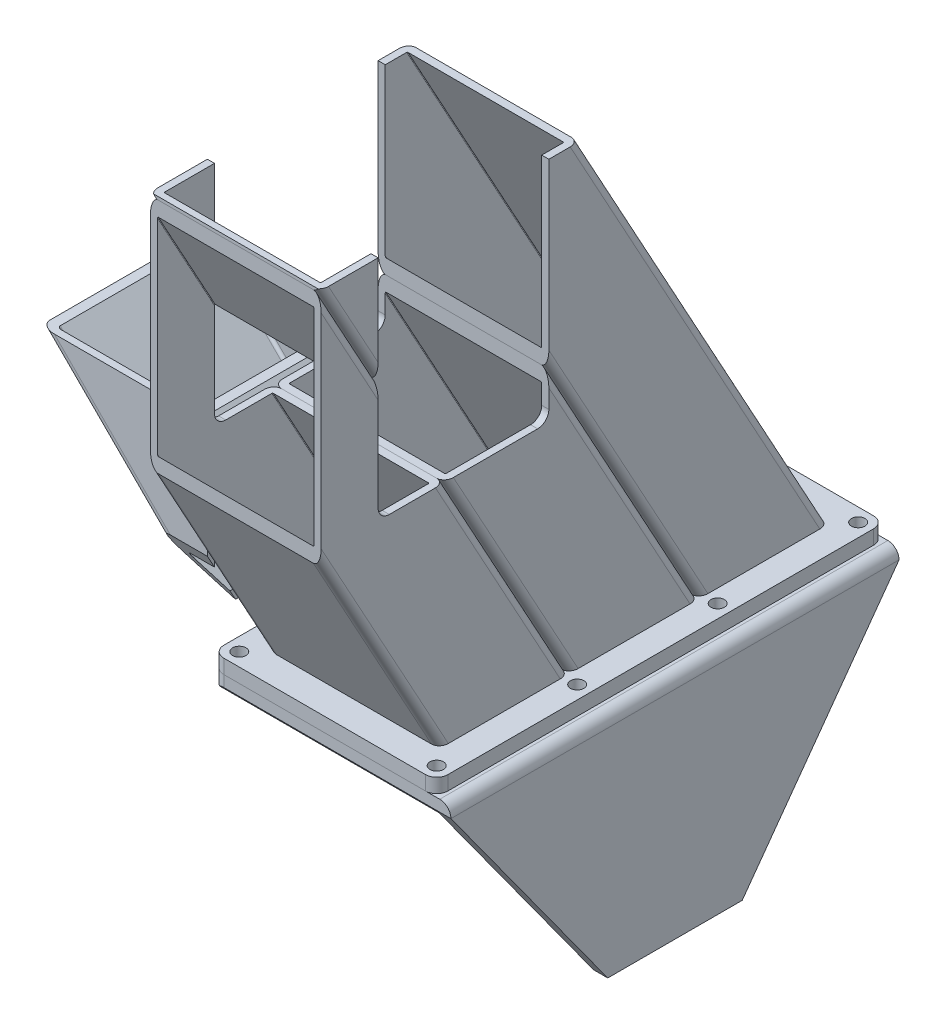
from build123d import *

# Parameters (mm, degrees)
BOSS_EXTRUDE1_DEPTH             = 328
BOSS_EXTRUDE1_DEPTH_BACK        = 70
CUT_EXTRUDE2_DEPTH              = 440.718513339
CUT_EXTRUDE2_DEPTH_BACK         = 328
SKETCH4_W                       = 313.0169186
SKETCH4_H                       = 132.220402889
SKETCH5_W                       = 100
SKETCH5_H                       = 200
SKETCH5_R                       = 3
BOSS_EXTRUDE2_DEPTH             = 6.35
FILLET1_R                       = 5
BOSS_EXTRUDE3_REACH             = 324.435
BOSS_EXTRUDE3_DIRECTION_2_REACH = 324.435
CUT_EXTRUDE3_DEPTH              = 166.35
DELETEFACE1_DEPTH               = 6.35
SKETCH9_W                       = 6.35
SKETCH9_H                       = 101.6
BOSS_EXTRUDE4_DEPTH             = 200
FILLET2_R                       = 5
CUT_EXTRUDE4_DEPTH              = 186.35


# Read off the part's stored shape, not the designer's step: DeleteFace1
with BuildPart() as part:
    # Sketch3 → Boss-Extrude1 (new, two sides: drawn at the far end of the back side and taken through both)
    with BuildSketch(Plane(origin=(0, 246.475671751, 135.020209169), x_dir=(-1, 0, 0), z_dir=(0, -0.8770281479329048, -0.4804389948093086)).offset(-BOSS_EXTRUDE1_DEPTH_BACK)):
        with BuildLine():
            Line((-3.5, -5.7132711), (-72.7, -5.7132711))
            ThreePointArc((-72.7, -5.7132711), (-75.174873734, -6.738397366), (-76.2, -9.2132711))
            Line((-76.2, -9.2132711), (-76.2, -53.0132711))
            ThreePointArc((-76.2, -53.0132711), (-75.174873734, -55.488144834), (-72.7, -56.5132711))
            Line((-72.7, -56.5132711), (-3.5, -56.5132711))
            ThreePointArc((-3.5, -56.5132711), (-1.025126266, -55.488144834), (0, -53.0132711))
            Line((0, -53.0132711), (0, -9.2132711))
            ThreePointArc((0, -9.2132711), (-1.025126266, -6.738397366), (-3.5, -5.7132711))
        make_face()
        with BuildLine():
            Line((-3.175, -9.2132711), (-3.175, -53.0132711))
            ThreePointArc((-3.175, -53.0132711), (-3.270190296, -53.243080804), (-3.5, -53.3382711))
            Line((-3.5, -53.3382711), (-72.7, -53.3382711))
            ThreePointArc((-72.7, -53.3382711), (-72.929809704, -53.243080804), (-73.025, -53.0132711))
            Line((-73.025, -53.0132711), (-73.025, -9.2132711))
            ThreePointArc((-73.025, -9.2132711), (-72.929809704, -8.983461396), (-72.7, -8.8882711))
            Line((-72.7, -8.8882711), (-3.5, -8.8882711))
            ThreePointArc((-3.5, -8.8882711), (-3.270190296, -8.983461396), (-3.175, -9.2132711))
        make_face(mode=Mode.SUBTRACT)
    extrude(amount=BOSS_EXTRUDE1_DEPTH + BOSS_EXTRUDE1_DEPTH_BACK)


with BuildPart() as body_2:
    # Mirror1: mirrored copy
    add(part.part.mirror(Plane(origin=(3.5, 280.716462946, 218.214668292), x_dir=(0, 0.8770281479329048, 0.48043899480930846), z_dir=(0, -0.4804389948093086, 0.8770281479329048))))


with BuildPart() as body_3:
    # Mirror2: mirrored copy
    add(body_2.part.mirror(Plane(origin=(3.5, 256.31016201, 262.767698207), x_dir=(0, 0.8770281479329051, 0.4804389948093081), z_dir=(0, -0.4804389948093086, 0.877028147932905))))


with BuildPart() as cut_extrude2_tool:
    # Sketch4 → Cut-Extrude2 (new, two sides: drawn at the far end of the back side and taken through both)
    with BuildSketch(Plane(origin=(0, 0, 0), x_dir=(0, 0, -1), z_dir=(1, 0, 0)).offset(-CUT_EXTRUDE2_DEPTH_BACK)):
        with Locations((-67.389705168, -53.410201445)):
            Rectangle(SKETCH4_W, SKETCH4_H)
        with BuildLine():
            Line((-214.6, 119.405), (-214.6, 216.11))
            Line((-214.6, 216.11), (-240, 216.11))
            Line((-240, 216.11), (-240, 57.182894208))
            Line((-240, 57.182894208), (-353.458801199, 57.182894208))
            Line((-353.458801199, 57.182894208), (-353.458801199, 355.056298198))
            Line((-353.458801199, 355.056298198), (-93.989438974, 355.056298198))
            Line((-93.989438974, 355.056298198), (-93.989438974, 216.11))
            Line((-93.989438974, 216.11), (-138.4, 216.11))
            Line((-138.4, 216.11), (-138.4, 119.405))
            ThreePointArc((-138.4, 119.405), (-139.864466094, 115.869466094), (-143.4, 114.405))
            Line((-143.4, 114.405), (-209.6, 114.405))
            ThreePointArc((-209.6, 114.405), (-213.135533906, 115.869466094), (-214.6, 119.405))
        make_face()
    extrude(amount=CUT_EXTRUDE2_DEPTH + CUT_EXTRUDE2_DEPTH_BACK)


with BuildPart() as part_1:
    add(part.part)

    # Cut-Extrude2: cut by cut_extrude2_tool
    add(cut_extrude2_tool.part, mode=Mode.SUBTRACT)


with BuildPart() as body_2_1:
    add(body_2.part)

    # Cut-Extrude2: cut by cut_extrude2_tool
    add(cut_extrude2_tool.part, mode=Mode.SUBTRACT)


with BuildPart() as body_3_1:
    add(body_3.part)

    # Cut-Extrude2: cut by cut_extrude2_tool
    add(cut_extrude2_tool.part, mode=Mode.SUBTRACT)


with BuildPart() as body_4:
    # Sketch5 → Boss-Extrude2 (new body)
    with BuildSketch(Plane.XZ.offset(-12.7)):
        with Locations((38.1, 100.355782812)):
            Rectangle(SKETCH5_W, SKETCH5_H)
        with Locations(Location((-5.95, 194.405782812, 0), (0, 0, 270))):
            Circle(SKETCH5_R, mode=Mode.SUBTRACT)
        with Locations(Location((82.15, 194.405782812, 0), (0, 0, 270))):
            Circle(SKETCH5_R, mode=Mode.SUBTRACT)
        with Locations(Location((-5.95, 131.705782812, 0), (0, 0, 270))):
            Circle(SKETCH5_R, mode=Mode.SUBTRACT)
        with Locations(Location((82.15, 131.705782812, 0), (0, 0, 270))):
            Circle(SKETCH5_R, mode=Mode.SUBTRACT)
        with Locations(Location((-5.95, 69.005782812, 0), (0, 0, 90))):
            Circle(SKETCH5_R, mode=Mode.SUBTRACT)
        with Locations(Location((-5.95, 6.305782812, 0), (0, 0, 90))):
            Circle(SKETCH5_R, mode=Mode.SUBTRACT)
        with Locations(Location((82.15, 6.305782812, 0), (0, 0, 90))):
            Circle(SKETCH5_R, mode=Mode.SUBTRACT)
        with Locations(Location((82.15, 69.005782812, 0), (0, 0, 90))):
            Circle(SKETCH5_R, mode=Mode.SUBTRACT)
    extrude(amount=BOSS_EXTRUDE2_DEPTH)

    # Fillet1
    fillet1_edges = [body_4.edges().sort_by_distance(p)[0] for p in [
        (-11.9, 9.525, 200.355782812),
        (88.1, 9.525, 200.355782812),
        (88.1, 9.525, 0.355782812),
        (-11.9, 9.525, 0.355782812),
    ]]
    fillet(fillet1_edges, radius=FILLET1_R)


with BuildPart() as body_5:
    # Boss-Extrude3: up to this plane
    boss_extrude3_end = Plane(origin=(0, 254.628625528, 265.837296725), z_dir=(-1, 0, 0))
    # Sketch7 → Boss-Extrude3 (new, up to the surface)
    with BuildSketch(Plane(origin=(-57.2025, 57.2025, 0), x_dir=(0.7071067811865488, 0.7071067811865462, 0), z_dir=(-0.7071067811865462, 0.7071067811865488, 0)), mode=Mode.PRIVATE) as boss_extrude3_sk1:
        with BuildLine():
            Line((32.596551302, -138.4), (74.396551302, -138.4))
            ThreePointArc((74.396551302, -138.4), (77.578531817, -139.718019485), (78.896551302, -142.9))
            Line((78.896551302, -142.9), (78.896551302, -210.1))
            ThreePointArc((78.896551302, -210.1), (77.578531817, -213.281980515), (74.396551302, -214.6))
            Line((74.396551302, -214.6), (32.596551302, -214.6))
            ThreePointArc((32.596551302, -214.6), (29.414570786, -213.281980515), (28.096551302, -210.1))
            Line((28.096551302, -210.1), (28.096551302, -142.9))
            ThreePointArc((28.096551302, -142.9), (29.414570786, -139.718019485), (32.596551302, -138.4))
        make_face()
        with BuildLine():
            Line((31.271551302, -142.9), (31.271551302, -210.1))
            ThreePointArc((31.271551302, -210.1), (31.659634817, -211.036916485), (32.596551302, -211.425))
            Line((32.596551302, -211.425), (74.396551302, -211.425))
            ThreePointArc((74.396551302, -211.425), (75.333467787, -211.036916485), (75.721551302, -210.1))
            Line((75.721551302, -210.1), (75.721551302, -142.9))
            ThreePointArc((75.721551302, -142.9), (75.333467787, -141.963083515), (74.396551302, -141.575))
            Line((74.396551302, -141.575), (32.596551302, -141.575))
            ThreePointArc((32.596551302, -141.575), (31.659634817, -141.963083515), (31.271551302, -142.9))
        make_face(mode=Mode.SUBTRACT)
    boss_extrude3_tool1 = split(extrude(boss_extrude3_sk1.sketch, amount=-BOSS_EXTRUDE3_REACH, mode=Mode.PRIVATE), bisect_by=boss_extrude3_end, keep=Keep.BOTH, mode=Mode.PRIVATE)
    add(boss_extrude3_tool1.solids().sort_by_distance((-35.945353, 78.459647, 140.365595))[0])

    # Boss-Extrude3 direction 2: up to this plane
    boss_extrude3_direction_2_end = Plane(origin=(76.2, 114.405, 143.4), z_dir=(0, 1, 0))
    # Sketch7 → Boss-Extrude3 direction 2 (add, up to the surface)
    with BuildSketch(Plane(origin=(-57.2025, 57.2025, 0), x_dir=(0.7071067811865488, 0.7071067811865462, 0), z_dir=(-0.7071067811865462, 0.7071067811865488, 0)), mode=Mode.PRIVATE) as boss_extrude3_direction_2_sk1:
        with BuildLine():
            Line((32.596551302, -138.4), (74.396551302, -138.4))
            ThreePointArc((74.396551302, -138.4), (77.578531817, -139.718019485), (78.896551302, -142.9))
            Line((78.896551302, -142.9), (78.896551302, -210.1))
            ThreePointArc((78.896551302, -210.1), (77.578531817, -213.281980515), (74.396551302, -214.6))
            Line((74.396551302, -214.6), (32.596551302, -214.6))
            ThreePointArc((32.596551302, -214.6), (29.414570786, -213.281980515), (28.096551302, -210.1))
            Line((28.096551302, -210.1), (28.096551302, -142.9))
            ThreePointArc((28.096551302, -142.9), (29.414570786, -139.718019485), (32.596551302, -138.4))
        make_face()
        with BuildLine():
            Line((31.271551302, -142.9), (31.271551302, -210.1))
            ThreePointArc((31.271551302, -210.1), (31.659634817, -211.036916485), (32.596551302, -211.425))
            Line((32.596551302, -211.425), (74.396551302, -211.425))
            ThreePointArc((74.396551302, -211.425), (75.333467787, -211.036916485), (75.721551302, -210.1))
            Line((75.721551302, -210.1), (75.721551302, -142.9))
            ThreePointArc((75.721551302, -142.9), (75.333467787, -141.963083515), (74.396551302, -141.575))
            Line((74.396551302, -141.575), (32.596551302, -141.575))
            ThreePointArc((32.596551302, -141.575), (31.659634817, -141.963083515), (31.271551302, -142.9))
        make_face(mode=Mode.SUBTRACT)
    boss_extrude3_direction_2_tool1 = split(extrude(boss_extrude3_direction_2_sk1.sketch, amount=BOSS_EXTRUDE3_DIRECTION_2_REACH, mode=Mode.PRIVATE), bisect_by=boss_extrude3_direction_2_end, keep=Keep.BOTH, mode=Mode.PRIVATE)
    add(boss_extrude3_direction_2_tool1.solids().sort_by_distance((-35.945353, 78.459647, 140.365595))[0])

    # Sketch8 → Cut-Extrude3 (cut)
    with BuildSketch(Plane(origin=(76.2, 0, 0), x_dir=(0, 0, -1), z_dir=(1, 0, 0))):
        Polygon((-240, 109.011726713), (-187.240109363, 12.7), (-240, 12.7), align=None)
    extrude(amount=-CUT_EXTRUDE3_DEPTH, mode=Mode.SUBTRACT)


with BuildPart() as body_6:
    # Mirror3: mirrored copy
    add(body_4.part.mirror(Plane.ZX.offset(6.35)))

    # DeleteFace1 outline → DeleteFace1 (add)
    with BuildSketch(Plane(origin=(0, 0, 0), x_dir=(1, 0, 0), z_dir=(0, 1, 0))):
        with BuildLine():
            Line((88.1, -200.355782812), (88.1, -195.355782812))
            ThreePointArc((88.1, -195.355782812), (86.635533906, -198.891316718), (83.1, -200.355782812))
            Line((83.1, -200.355782812), (88.1, -200.355782812))
        make_face()
        with BuildLine():
            ThreePointArc((83.1, -0.355782812), (86.635533906, -1.820248906), (88.1, -5.355782812))
            Line((88.1, -5.355782812), (88.1, -0.355782812))
            Line((88.1, -0.355782812), (83.1, -0.355782812))
        make_face()
    extrude(amount=DELETEFACE1_DEPTH)

    # Sketch9 → Boss-Extrude4 (add)
    with BuildSketch(Plane(origin=(0, 0, 0.355782812), x_dir=(-1, 0, 0), z_dir=(0, 0, -1))):
        with Locations((-91.275, -44.45)):
            Rectangle(SKETCH9_W, SKETCH9_H)
    extrude(amount=-BOSS_EXTRUDE4_DEPTH)

    # Fillet2
    fillet2_edges = [body_6.edges().sort_by_distance(p)[0] for p in [
        (94.45, 6.35, 100.355782812),
    ]]
    fillet(fillet2_edges, radius=FILLET2_R)

    # Sketch10 → Cut-Extrude4 (cut)
    with BuildSketch(Plane(origin=(94.45, 0, 0), x_dir=(0, 0, -1), z_dir=(1, 0, 0))):
        Polygon((-200.355782812, 1.35), (-200.355782812, -95.25), (-130.355782812, -95.25), align=None)
        Polygon((-70.355782812, -95.25), (-0.355782812, 1.35), (-0.355782812, -95.25), align=None)
    extrude(amount=-CUT_EXTRUDE4_DEPTH, mode=Mode.SUBTRACT)


solid = Compound([part_1.part, body_2_1.part, body_3_1.part, body_4.part, body_5.part, body_6.part])
